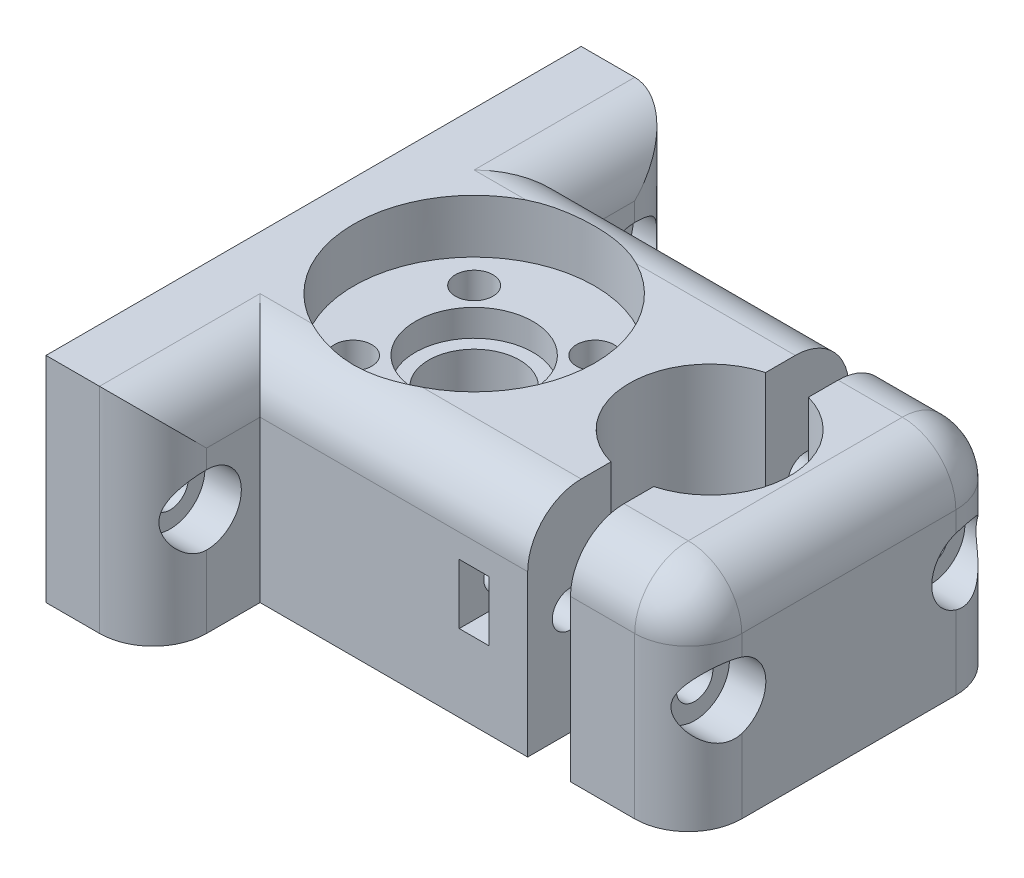
from build123d import *

# Parameters (mm, degrees)
SKETCH1_W                                           = 30
SKETCH1_H                                           = 20
BOSS_EXTRUDE1_DEPTH                                 = 50
SKETCH2_R                                           = 4.25
SKETCH2_R_2                                         = 7.5
CUT_EXTRUDE1_DEPTH                                  = 56.901699437
SKETCH4_R                                           = 11.25
CUT_EXTRUDE3_DEPTH                                  = 5
SKETCH5_R                                           = 1.75
CUT_EXTRUDE4_DEPTH                                  = 55.313902456
CUT_EXTRUDE5_DEPTH                                  = 6
SKETCH7_W                                           = 10
SKETCH7_H                                           = 20
BOSS_EXTRUDE2_DEPTH                                 = 10
CBORE_FOR_M3_HEX_SOCKET_HEAD_CAP_SCREW4_D           = 3.4
CBORE_FOR_M3_HEX_SOCKET_HEAD_CAP_SCREW4_CBORE_D     = 6.5
CBORE_FOR_M3_HEX_SOCKET_HEAD_CAP_SCREW4_CBORE_DEPTH = 3.4
CBORE_FOR_M3_HEX_SOCKET_HEAD_CAP_SCREW3_D           = 3.4
CBORE_FOR_M3_HEX_SOCKET_HEAD_CAP_SCREW3_CBORE_D     = 6.5
CBORE_FOR_M3_HEX_SOCKET_HEAD_CAP_SCREW3_CBORE_DEPTH = 3.4
SKETCH18_W                                          = 2.8
SKETCH18_H                                          = 5.6
CUT_EXTRUDE8_DEPTH                                  = 6.8
SKETCH3_W                                           = 4
SKETCH3_H                                           = 30
CUT_EXTRUDE9_DEPTH                                  = 60.371710435
FILLET4_R                                           = 5
FILLET5_R                                           = 5
SKETCH19_R                                          = 5.5
CUT_EXTRUDE10_DEPTH                                 = 2.5


with BuildPart() as part:
    # Sketch1 → Boss-Extrude1 (new body)
    with BuildSketch(Plane(origin=(0, 0, 0), x_dir=(0, 0, -1), z_dir=(1, 0, 0))):
        Rectangle(SKETCH1_W, SKETCH1_H)
    extrude(amount=BOSS_EXTRUDE1_DEPTH)

    # Sketch2 → Cut-Extrude1 (cut, through all)
    with BuildSketch(Plane(origin=(0, 10, 0), x_dir=(1, 0, 0), z_dir=(0, 1, 0))):
        with Locations(Location((15, 0, 0), (0, 0, 270))):
            Circle(SKETCH2_R)
        with Locations(Location((37, 0, 0), (0, 0, 270))):
            Circle(SKETCH2_R_2)
    extrude(amount=-CUT_EXTRUDE1_DEPTH, mode=Mode.SUBTRACT)

    # Sketch4 → Cut-Extrude3 (cut)
    with BuildSketch(Plane(origin=(0, 10, 0), x_dir=(1, 0, 0), z_dir=(0, 1, 0))):
        with Locations(Location((15, 0, 0), (0, 0, 270))):
            Circle(SKETCH4_R)
    extrude(amount=-CUT_EXTRUDE3_DEPTH, mode=Mode.SUBTRACT)

    # Sketch5 → Cut-Extrude4 (cut, through all)
    with BuildSketch(Plane(origin=(0, 5, 0), x_dir=(1, 0, 0), z_dir=(0, 1, 0))):
        with Locations(Location((9.343145751, -5.656854249, 0), (0, 0, 270))):
            Circle(SKETCH5_R)
        with Locations(Location((9.343145751, 5.656854249, 0), (0, 0, 270))):
            Circle(SKETCH5_R)
        with Locations(Location((20.656854249, 5.656854249, 0), (0, 0, 270))):
            Circle(SKETCH5_R)
        with Locations(Location((20.656854249, -5.656854249, 0), (0, 0, 270))):
            Circle(SKETCH5_R)
    extrude(amount=-CUT_EXTRUDE4_DEPTH, mode=Mode.SUBTRACT)

    # Sketch6 → Cut-Extrude5 (cut)
    with BuildSketch(Plane.XZ.offset(10)):
        Polygon((12.690407486, 5.752625887), (10.933835947, 8.603553764), (7.586574212, 8.507782127), (5.995884015, 5.561082612), (7.752455554, 2.710154735), (11.099717289, 2.805926372), align=None)
        Polygon((17.309592514, 5.752625887), (18.900282711, 2.805926372), (22.247544446, 2.710154735), (24.004115985, 5.561082612), (22.413425788, 8.507782127), (19.066164053, 8.603553764), align=None)
        Polygon((24.004260181, -5.747446002), (22.409011974, -2.803211553), (19.061606043, -2.7126198), (17.309448318, -5.566262497), (18.904696525, -8.510496946), (22.252102456, -8.601088699), align=None)
        Polygon((12.690407486, -5.752625887), (11.099717289, -2.805926372), (7.752455554, -2.710154735), (5.995884015, -5.561082612), (7.586574212, -8.507782127), (10.933835947, -8.603553764), align=None)
    extrude(amount=-CUT_EXTRUDE5_DEPTH, mode=Mode.SUBTRACT)

    # Sketch7 → Boss-Extrude2 (add)
    with BuildSketch(Plane.XY.offset(15)):
        with Locations((5, 0)):
            Rectangle(SKETCH7_W, SKETCH7_H)
    boss_extrude2 = extrude(amount=BOSS_EXTRUDE2_DEPTH)

    # CBORE for M3 Hex Socket Head Cap Screw4 (through all)
    with Locations(Plane(origin=(10, 0, 0), x_dir=(0, 0, -1), z_dir=(1, 0, 0))):
        with Locations((-20, 0)):
            cbore_for_m3_hex_socket_head_cap_screw4 = CounterBoreHole(CBORE_FOR_M3_HEX_SOCKET_HEAD_CAP_SCREW4_D / 2, CBORE_FOR_M3_HEX_SOCKET_HEAD_CAP_SCREW4_CBORE_D / 2, CBORE_FOR_M3_HEX_SOCKET_HEAD_CAP_SCREW4_CBORE_DEPTH)

    # CBORE for M3 Hex Socket Head Cap Screw3 (through all)
    with Locations(Plane(origin=(50, 0, 0), x_dir=(0, 0, -1), z_dir=(1, 0, 0))):
        with Locations((-11, 0)):
            cbore_for_m3_hex_socket_head_cap_screw3 = CounterBoreHole(CBORE_FOR_M3_HEX_SOCKET_HEAD_CAP_SCREW3_D / 2, CBORE_FOR_M3_HEX_SOCKET_HEAD_CAP_SCREW3_CBORE_D / 2, CBORE_FOR_M3_HEX_SOCKET_HEAD_CAP_SCREW3_CBORE_DEPTH)

    # Sketch18 → Cut-Extrude8 (cut)
    with BuildSketch(Plane.XY.offset(15)):
        with Locations((30.004152543, 0)):
            Rectangle(SKETCH18_W, SKETCH18_H)
    cut_extrude8 = extrude(amount=-CUT_EXTRUDE8_DEPTH, mode=Mode.SUBTRACT)

    # Mirror9: Boss-Extrude2, CBORE for M3 Hex Socket Head Cap Screw4, CBORE for M3 Hex Socket Head Cap Screw3, Cut-Extrude8 across plane
    add(boss_extrude2.mirror(Plane(origin=(0, 0, 0), x_dir=(1, 0, 0), z_dir=(0, 0, -1))))
    add(cbore_for_m3_hex_socket_head_cap_screw4.mirror(Plane(origin=(0, 0, 0), x_dir=(1, 0, 0), z_dir=(0, 0, -1))), mode=Mode.SUBTRACT)
    add(cbore_for_m3_hex_socket_head_cap_screw3.mirror(Plane(origin=(0, 0, 0), x_dir=(1, 0, 0), z_dir=(0, 0, -1))), mode=Mode.SUBTRACT)
    add(cut_extrude8.mirror(Plane(origin=(0, 0, 0), x_dir=(1, 0, 0), z_dir=(0, 0, -1))), mode=Mode.SUBTRACT)

    # Sketch3 → Cut-Extrude9 (cut, through all)
    with BuildSketch(Plane(origin=(0, 10, 0), x_dir=(1, 0, 0), z_dir=(0, 1, 0))):
        with Locations((37, 0)):
            Rectangle(SKETCH3_W, SKETCH3_H)
    extrude(amount=-CUT_EXTRUDE9_DEPTH, mode=Mode.SUBTRACT)


with BuildPart() as cut_extrude9_piece_1:
    # of the separate pieces the step leaves, piece 1, a body of its own (cut_extrude9_pieces)
    add(part.part.solids().sort_by_distance((10, -10, 15))[0])

    # Fillet4
    # the kernel refuses this fillet: 5 mm, written as the material it takes off along each edge
    with BuildSketch(Plane(origin=(10, 10, 25), x_dir=(0, 0, -1), z_dir=(0, -1, 0)), Plane(origin=(10, 10, -25), x_dir=(-1, 0, 0), z_dir=(0, -1, 0))) as fillet4_piece_1:
        with BuildLine():
            CenterArc((FILLET4_R, -FILLET4_R), FILLET4_R, 90, 90)
            Line((0, -FILLET4_R), (-FILLET4_R * 0.02, -FILLET4_R))
            Line((-FILLET4_R * 0.02, -FILLET4_R), (-FILLET4_R * 0.02, FILLET4_R * 0.02))
            Line((-FILLET4_R * 0.02, FILLET4_R * 0.02), (FILLET4_R, FILLET4_R * 0.02))
            Line((FILLET4_R, FILLET4_R * 0.02), (FILLET4_R, 0))
        make_face()
    extrude(amount=20, mode=Mode.SUBTRACT)
    with BuildSketch(Plane(origin=(10, 10, -15), x_dir=(0, -1, 0), z_dir=(0, 0, -1))) as fillet4_piece_2:
        with BuildLine():
            CenterArc((FILLET4_R, FILLET4_R), FILLET4_R, 180, 90)
            Line((0, FILLET4_R), (-FILLET4_R * 0.02, FILLET4_R))
            Line((-FILLET4_R * 0.02, FILLET4_R), (-FILLET4_R * 0.02, -FILLET4_R * 0.02))
            Line((-FILLET4_R * 0.02, -FILLET4_R * 0.02), (FILLET4_R, -FILLET4_R * 0.02))
            Line((FILLET4_R, -FILLET4_R * 0.02), (FILLET4_R, 0))
        make_face()
    extrude(amount=10, mode=Mode.SUBTRACT)
    with BuildSketch(Plane(origin=(10, 10, 15), x_dir=(0, -1, 0), z_dir=(1, 0, 0))) as fillet4_piece_3:
        with BuildLine():
            CenterArc((FILLET4_R, FILLET4_R), FILLET4_R, 180, 90)
            Line((0, FILLET4_R), (-FILLET4_R * 0.02, FILLET4_R))
            Line((-FILLET4_R * 0.02, FILLET4_R), (-FILLET4_R * 0.02, -FILLET4_R * 0.02))
            Line((-FILLET4_R * 0.02, -FILLET4_R * 0.02), (FILLET4_R, -FILLET4_R * 0.02))
            Line((FILLET4_R, -FILLET4_R * 0.02), (FILLET4_R, 0))
        make_face()
    extrude(amount=25, mode=Mode.SUBTRACT)
    with BuildSketch(Plane(origin=(10, 10, -15), x_dir=(0, -1, 0), z_dir=(1, 0, 0))) as fillet4_piece_4:
        with BuildLine():
            CenterArc((FILLET4_R, -FILLET4_R), FILLET4_R, 90, 90)
            Line((0, -FILLET4_R), (-FILLET4_R * 0.02, -FILLET4_R))
            Line((-FILLET4_R * 0.02, -FILLET4_R), (-FILLET4_R * 0.02, FILLET4_R * 0.02))
            Line((-FILLET4_R * 0.02, FILLET4_R * 0.02), (FILLET4_R, FILLET4_R * 0.02))
            Line((FILLET4_R, FILLET4_R * 0.02), (FILLET4_R, 0))
        make_face()
    extrude(amount=25, mode=Mode.SUBTRACT)
    with BuildSketch(Plane(origin=(10, 10, 15), x_dir=(0, -1, 0), z_dir=(0, 0, 1))) as fillet4_piece_5:
        with BuildLine():
            CenterArc((FILLET4_R, -FILLET4_R), FILLET4_R, 90, 90)
            Line((0, -FILLET4_R), (-FILLET4_R * 0.02, -FILLET4_R))
            Line((-FILLET4_R * 0.02, -FILLET4_R), (-FILLET4_R * 0.02, FILLET4_R * 0.02))
            Line((-FILLET4_R * 0.02, FILLET4_R * 0.02), (FILLET4_R, FILLET4_R * 0.02))
            Line((FILLET4_R, FILLET4_R * 0.02), (FILLET4_R, 0))
        make_face()
    extrude(amount=10, mode=Mode.SUBTRACT)
    with BuildSketch(Plane(origin=(10, 10, 15), x_dir=(0, -1, 0), z_dir=(0, 0, 1))) as fillet4_piece_6a_section:
        with BuildLine():
            CenterArc((FILLET4_R, -FILLET4_R), FILLET4_R, 90, 90)
            Line((0, -FILLET4_R), (-FILLET4_R * 0.02, -FILLET4_R))
            Line((-FILLET4_R * 0.02, -FILLET4_R), (-FILLET4_R * 0.02, FILLET4_R * 0.02))
            Line((-FILLET4_R * 0.02, FILLET4_R * 0.02), (FILLET4_R, FILLET4_R * 0.02))
            Line((FILLET4_R, FILLET4_R * 0.02), (FILLET4_R, 0))
        make_face()
    fillet4_piece_6a = extrude(amount=22.5, mode=Mode.PRIVATE)
    fillet4_piece_6a = split(fillet4_piece_6a, bisect_by=Plane(origin=(8.868024429, 8.868024429, 25), z_dir=(0, 0, 1)), keep=Keep.TOP, mode=Mode.PRIVATE)
    with BuildSketch(Plane(origin=(10, 22.5, 25), x_dir=(0, 0, -1), z_dir=(0, -1, 0))) as fillet4_piece_6b_section:
        with BuildLine():
            CenterArc((FILLET4_R, -FILLET4_R), FILLET4_R, 90, 90)
            Line((0, -FILLET4_R), (-FILLET4_R * 0.02, -FILLET4_R))
            Line((-FILLET4_R * 0.02, -FILLET4_R), (-FILLET4_R * 0.02, FILLET4_R * 0.02))
            Line((-FILLET4_R * 0.02, FILLET4_R * 0.02), (FILLET4_R, FILLET4_R * 0.02))
            Line((FILLET4_R, FILLET4_R * 0.02), (FILLET4_R, 0))
        make_face()
    fillet4_piece_6b = extrude(amount=32.5, mode=Mode.PRIVATE)
    fillet4_piece_6b = split(fillet4_piece_6b, bisect_by=Plane(origin=(8.868024429, 10, 23.868024429), z_dir=(0, 1, 0)), keep=Keep.TOP, mode=Mode.PRIVATE)
    fillet4_piece_6 = fillet4_piece_6a & fillet4_piece_6b
    add(fillet4_piece_6, mode=Mode.SUBTRACT)
    with BuildSketch(Plane(origin=(10, 22.5, -25), x_dir=(-1, 0, 0), z_dir=(0, -1, 0))) as fillet4_piece_7a_section:
        with BuildLine():
            CenterArc((FILLET4_R, -FILLET4_R), FILLET4_R, 90, 90)
            Line((0, -FILLET4_R), (-FILLET4_R * 0.02, -FILLET4_R))
            Line((-FILLET4_R * 0.02, -FILLET4_R), (-FILLET4_R * 0.02, FILLET4_R * 0.02))
            Line((-FILLET4_R * 0.02, FILLET4_R * 0.02), (FILLET4_R, FILLET4_R * 0.02))
            Line((FILLET4_R, FILLET4_R * 0.02), (FILLET4_R, 0))
        make_face()
    fillet4_piece_7a = extrude(amount=32.5, mode=Mode.PRIVATE)
    fillet4_piece_7a = split(fillet4_piece_7a, bisect_by=Plane(origin=(8.868024429, 10, -23.868024429), z_dir=(0, 1, 0)), keep=Keep.TOP, mode=Mode.PRIVATE)
    with BuildSketch(Plane(origin=(10, 10, -15), x_dir=(0, -1, 0), z_dir=(0, 0, -1))) as fillet4_piece_7b_section:
        with BuildLine():
            CenterArc((FILLET4_R, FILLET4_R), FILLET4_R, 180, 90)
            Line((0, FILLET4_R), (-FILLET4_R * 0.02, FILLET4_R))
            Line((-FILLET4_R * 0.02, FILLET4_R), (-FILLET4_R * 0.02, -FILLET4_R * 0.02))
            Line((-FILLET4_R * 0.02, -FILLET4_R * 0.02), (FILLET4_R, -FILLET4_R * 0.02))
            Line((FILLET4_R, -FILLET4_R * 0.02), (FILLET4_R, 0))
        make_face()
    fillet4_piece_7b = extrude(amount=22.5, mode=Mode.PRIVATE)
    fillet4_piece_7b = split(fillet4_piece_7b, bisect_by=Plane(origin=(8.868024429, 8.868024429, -25), z_dir=(0, 0, -1)), keep=Keep.TOP, mode=Mode.PRIVATE)
    fillet4_piece_7 = fillet4_piece_7a & fillet4_piece_7b
    add(fillet4_piece_7, mode=Mode.SUBTRACT)
    with BuildSketch(Plane(origin=(10, 10, -2.5), x_dir=(0, -1, 0), z_dir=(0, 0, -1))) as fillet4_piece_8a_section:
        with BuildLine():
            CenterArc((FILLET4_R, FILLET4_R), FILLET4_R, 180, 90)
            Line((0, FILLET4_R), (-FILLET4_R * 0.02, FILLET4_R))
            Line((-FILLET4_R * 0.02, FILLET4_R), (-FILLET4_R * 0.02, -FILLET4_R * 0.02))
            Line((-FILLET4_R * 0.02, -FILLET4_R * 0.02), (FILLET4_R, -FILLET4_R * 0.02))
            Line((FILLET4_R, -FILLET4_R * 0.02), (FILLET4_R, 0))
        make_face()
    fillet4_piece_8a = extrude(amount=22.5, mode=Mode.PRIVATE)
    fillet4_piece_8a = split(fillet4_piece_8a, bisect_by=Plane(origin=(8.868024429, 8.868024429, -15), z_dir=(0, 0, 1)), keep=Keep.TOP, mode=Mode.PRIVATE)
    with BuildSketch(Plane(origin=(-2.5, 10, -15), x_dir=(0, -1, 0), z_dir=(1, 0, 0))) as fillet4_piece_8b_section:
        with BuildLine():
            CenterArc((FILLET4_R, -FILLET4_R), FILLET4_R, 90, 90)
            Line((0, -FILLET4_R), (-FILLET4_R * 0.02, -FILLET4_R))
            Line((-FILLET4_R * 0.02, -FILLET4_R), (-FILLET4_R * 0.02, FILLET4_R * 0.02))
            Line((-FILLET4_R * 0.02, FILLET4_R * 0.02), (FILLET4_R, FILLET4_R * 0.02))
            Line((FILLET4_R, FILLET4_R * 0.02), (FILLET4_R, 0))
        make_face()
    fillet4_piece_8b = extrude(amount=37.5, mode=Mode.PRIVATE)
    fillet4_piece_8b = split(fillet4_piece_8b, bisect_by=Plane(origin=(10, 8.868024429, -13.868024429), z_dir=(-1, 0, 0)), keep=Keep.TOP, mode=Mode.PRIVATE)
    fillet4_piece_8 = fillet4_piece_8a & fillet4_piece_8b
    add(fillet4_piece_8, mode=Mode.SUBTRACT)
    with BuildSketch(Plane(origin=(10, 10, 2.5), x_dir=(0, -1, 0), z_dir=(0, 0, 1))) as fillet4_piece_9a_section:
        with BuildLine():
            CenterArc((FILLET4_R, -FILLET4_R), FILLET4_R, 90, 90)
            Line((0, -FILLET4_R), (-FILLET4_R * 0.02, -FILLET4_R))
            Line((-FILLET4_R * 0.02, -FILLET4_R), (-FILLET4_R * 0.02, FILLET4_R * 0.02))
            Line((-FILLET4_R * 0.02, FILLET4_R * 0.02), (FILLET4_R, FILLET4_R * 0.02))
            Line((FILLET4_R, FILLET4_R * 0.02), (FILLET4_R, 0))
        make_face()
    fillet4_piece_9a = extrude(amount=22.5, mode=Mode.PRIVATE)
    fillet4_piece_9a = split(fillet4_piece_9a, bisect_by=Plane(origin=(8.868024429, 8.868024429, 15), z_dir=(0, 0, -1)), keep=Keep.TOP, mode=Mode.PRIVATE)
    with BuildSketch(Plane(origin=(-2.5, 10, 15), x_dir=(0, -1, 0), z_dir=(1, 0, 0))) as fillet4_piece_9b_section:
        with BuildLine():
            CenterArc((FILLET4_R, FILLET4_R), FILLET4_R, 180, 90)
            Line((0, FILLET4_R), (-FILLET4_R * 0.02, FILLET4_R))
            Line((-FILLET4_R * 0.02, FILLET4_R), (-FILLET4_R * 0.02, -FILLET4_R * 0.02))
            Line((-FILLET4_R * 0.02, -FILLET4_R * 0.02), (FILLET4_R, -FILLET4_R * 0.02))
            Line((FILLET4_R, -FILLET4_R * 0.02), (FILLET4_R, 0))
        make_face()
    fillet4_piece_9b = extrude(amount=37.5, mode=Mode.PRIVATE)
    fillet4_piece_9b = split(fillet4_piece_9b, bisect_by=Plane(origin=(10, 8.868024429, 13.868024429), z_dir=(-1, 0, 0)), keep=Keep.TOP, mode=Mode.PRIVATE)
    fillet4_piece_9 = fillet4_piece_9a & fillet4_piece_9b
    add(fillet4_piece_9, mode=Mode.SUBTRACT)

    # Sketch19 → Cut-Extrude10 (cut)
    with BuildSketch(Plane(origin=(0, 5, 0), x_dir=(1, 0, 0), z_dir=(0, 1, 0))):
        with Locations(Location((15, 0, 0), (0, 0, 270))):
            Circle(SKETCH19_R)
    extrude(amount=-CUT_EXTRUDE10_DEPTH, mode=Mode.SUBTRACT)


with BuildPart() as cut_extrude9_piece_2:
    # of the separate pieces the step leaves, piece 2, a body of its own (cut_extrude9_pieces)
    add(part.part.solids().sort_by_distance((39, -10, 15))[0])

    # Fillet5
    # the kernel refuses this fillet: 5 mm, written as the material it takes off along each edge
    with BuildSketch(Plane(origin=(45, 5, 10), x_dir=(0, 0, 1), z_dir=(1, 0, 0))) as fillet5_piece_1_section:
        Polygon((0, 0), (FILLET5_R, 0), (FILLET5_R, -FILLET5_R), (0, -FILLET5_R), align=None)
    fillet5_piece_1 = extrude(amount=FILLET5_R, mode=Mode.PRIVATE)
    fillet5_piece_1 = fillet5_piece_1 - Plane(origin=(45, 5, 10), x_dir=(0, -0.7071067811865475, -0.7071067811865475), z_dir=(1, 0, 0)) * Sphere(FILLET5_R, mode=Mode.PRIVATE)
    add(fillet5_piece_1, mode=Mode.SUBTRACT)
    with BuildSketch(Plane(origin=(45, 5, -10), x_dir=(1, 0, 0), z_dir=(0, 0, -1))) as fillet5_piece_2_section:
        Polygon((0, 0), (FILLET5_R, 0), (FILLET5_R, -FILLET5_R), (0, -FILLET5_R), align=None)
    fillet5_piece_2 = extrude(amount=FILLET5_R, mode=Mode.PRIVATE)
    fillet5_piece_2 = fillet5_piece_2 - Plane(origin=(45, 5, -10), x_dir=(-0.7071067811865475, -0.7071067811865475, 0), z_dir=(0, 0, -1)) * Sphere(FILLET5_R, mode=Mode.PRIVATE)
    add(fillet5_piece_2, mode=Mode.SUBTRACT)
    with BuildSketch(Plane(origin=(50, 5, 15), x_dir=(0, 0, -1), z_dir=(0, -1, 0))) as fillet5_piece_3:
        with BuildLine():
            CenterArc((FILLET5_R, -FILLET5_R), FILLET5_R, 90, 90)
            Line((0, -FILLET5_R), (0, 0))
            Line((0, 0), (FILLET5_R, 0))
        make_face()
    extrude(amount=27.5, mode=Mode.SUBTRACT)
    with BuildSketch(Plane(origin=(50, -22.5, -15), x_dir=(-1, 0, 0), z_dir=(0, 1, 0))) as fillet5_piece_4:
        with BuildLine():
            CenterArc((FILLET5_R, FILLET5_R), FILLET5_R, 180, 90)
            Line((0, FILLET5_R), (0, 0))
            Line((0, 0), (FILLET5_R, 0))
        make_face()
    extrude(amount=27.5, mode=Mode.SUBTRACT)
    with BuildSketch(Plane(origin=(50, 10, -10), x_dir=(0, -1, 0), z_dir=(0, 0, 1))) as fillet5_piece_5:
        with BuildLine():
            CenterArc((FILLET5_R, -FILLET5_R), FILLET5_R, 90, 90)
            Line((0, -FILLET5_R), (0, 0))
            Line((0, 0), (FILLET5_R, 0))
        make_face()
    extrude(amount=20, mode=Mode.SUBTRACT)
    with BuildSketch(Plane(origin=(26.5, 10, 15), x_dir=(0, -1, 0), z_dir=(1, 0, 0))) as fillet5_piece_6:
        with BuildLine():
            CenterArc((FILLET5_R, FILLET5_R), FILLET5_R, 180, 90)
            Line((0, FILLET5_R), (0, 0))
            Line((0, 0), (FILLET5_R, 0))
        make_face()
    extrude(amount=18.5, mode=Mode.SUBTRACT)
    with BuildSketch(Plane(origin=(26.5, 10, -15), x_dir=(0, -1, 0), z_dir=(1, 0, 0))) as fillet5_piece_7:
        with BuildLine():
            CenterArc((FILLET5_R, -FILLET5_R), FILLET5_R, 90, 90)
            Line((0, -FILLET5_R), (0, 0))
            Line((0, 0), (FILLET5_R, 0))
        make_face()
    extrude(amount=18.5, mode=Mode.SUBTRACT)


solid = Compound([cut_extrude9_piece_1.part, cut_extrude9_piece_2.part])
